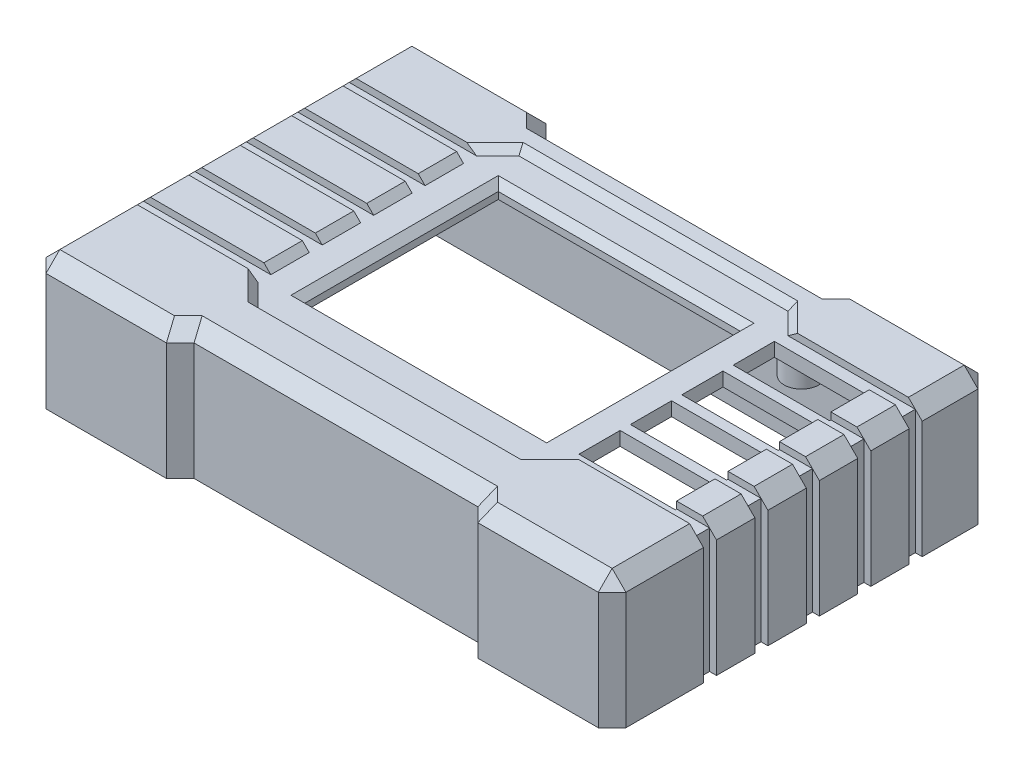
from build123d import *

# Parameters (mm, degrees)
SKETCH_1_W          = 74
SKETCH_1_H          = 45
SKETCH_1_W_2        = 35.04
SKETCH_1_H_2        = 28.03
SKETCH_1_W_3        = 13.543974178
SKETCH_1_H_3        = 5.562046036
EXTRUDE_1_DEPTH     = 2
SKETCH_2_W          = 45
SKETCH_2_H          = 18
EXTRUDE_2_DEPTH     = 4
SKETCH_3_W          = 45
SKETCH_3_H          = 18
EXTRUDE_3_DEPTH     = 4
SKETCH_4_W          = 82
SKETCH_4_H          = 18
EXTRUDE_4_DEPTH     = 3
SKETCH_5_W          = 82
SKETCH_5_H          = 18
EXTRUDE_5_DEPTH     = 3
SKETCH_7_W          = 4.978012911
SKETCH_7_H          = 5.562046036
SKETCH_7_W_2        = 18.446306877
EXTRUDE_6_DEPTH     = 1
SKETCH_8_W          = 5.562046036
SKETCH_8_H          = 19
SKETCH_8_W_2        = 11.231023018
SKETCH_8_W_3        = 8.081023018
EXTRUDE_7_DEPTH     = 1
SKETCH_9_W          = 5.562046036
SKETCH_9_H          = 19
SKETCH_9_W_2        = 11.231023018
SKETCH_9_W_3        = 8.081023018
EXTRUDE_8_DEPTH     = 1
EXTRUDE_9_DEPTH     = 19
CHAMFER_15_SIZE     = 2
CHAMFER_16_SIZE     = 1
SKETCH_12_R         = 2.5
SKETCH_12_R_2       = 0.9
EXTRUDE_10_DEPTH    = 3.25
EXTRUDE_11_DEPTH    = 16
SKETCH_15_R         = 0.9
CUT_EXTRUDE_1_DEPTH = 16
SKETCH_16_R         = 1.6
CUT_EXTRUDE_3_DEPTH = 86.166014348
CUT_EXTRUDE_4_DEPTH = 86.166014348
CUT_EXTRUDE_5_DEPTH = 2.5
CHAMFER_17_SIZE     = 1
SKETCH_19_W         = 13.943974178
SKETCH_19_H         = 5.962046036
CUT_EXTRUDE_6_DEPTH = 3
SKETCH_20_R         = 3.2
CUT_EXTRUDE_7_DEPTH = 2.2
CHAMFER_18_SIZE     = 1


with BuildPart() as part:
    # Эскиз1 → Бобышка-Вытянуть1 (new body)
    with BuildSketch(Plane(origin=(0, 0, 0), x_dir=(1, 0, 0), z_dir=(0, 1, 0))):
        Rectangle(SKETCH_1_W, SKETCH_1_H)
        with Locations((0, 1.516023018)):
            Rectangle(SKETCH_1_W_2, SKETCH_1_H_2, mode=Mode.SUBTRACT)
        with Locations((29.25, 12.75)):
            Rectangle(SKETCH_1_W_3, SKETCH_1_H_3, mode=Mode.SUBTRACT)
        with Locations((29.25, 5.3)):
            Rectangle(SKETCH_1_W_3, SKETCH_1_H_3, mode=Mode.SUBTRACT)
        with Locations((29.25, -2.15)):
            Rectangle(SKETCH_1_W_3, SKETCH_1_H_3, mode=Mode.SUBTRACT)
        with Locations((29.25, -9.6)):
            Rectangle(SKETCH_1_W_3, SKETCH_1_H_3, mode=Mode.SUBTRACT)
    extrude(amount=EXTRUDE_1_DEPTH)

    # Эскиз2 → Бобышка-Вытянуть2 (add)
    with BuildSketch(Plane.ZY.offset(37)):
        with Locations((0, -7)):
            Rectangle(SKETCH_2_W, SKETCH_2_H)
    extrude(amount=EXTRUDE_2_DEPTH)

    # Эскиз3 → Бобышка-Вытянуть3 (add)
    with BuildSketch(Plane(origin=(37, 0, 0), x_dir=(0, 0, -1), z_dir=(1, 0, 0))):
        with Locations((0, -7)):
            Rectangle(SKETCH_3_W, SKETCH_3_H)
    extrude(amount=EXTRUDE_3_DEPTH)

    # Эскиз4 → Бобышка-Вытянуть4 (add)
    with BuildSketch(Plane(origin=(0, 0, -22.5), x_dir=(-1, 0, 0), z_dir=(0, 0, -1))):
        with Locations((0, -7)):
            Rectangle(SKETCH_4_W, SKETCH_4_H)
    extrude(amount=EXTRUDE_4_DEPTH)

    # Эскиз5 → Бобышка-Вытянуть5 (add)
    with BuildSketch(Plane.XY.offset(22.5)):
        with Locations((0, -7)):
            Rectangle(SKETCH_5_W, SKETCH_5_H)
    extrude(amount=EXTRUDE_5_DEPTH)

    # Эскиз7 → Бобышка-Вытянуть6 (add)
    with BuildSketch(Plane(origin=(0, 2, 0), x_dir=(1, 0, 0), z_dir=(0, 1, 0))):
        with Locations((38.510993544, 12.75)):
            Rectangle(SKETCH_7_W, SKETCH_7_H)
        with Locations((-31.776846562, -9.6)):
            Rectangle(SKETCH_7_W_2, SKETCH_7_H)
        with Locations((-31.776846562, -2.15)):
            Rectangle(SKETCH_7_W_2, SKETCH_7_H)
        with Locations((-31.776846562, 5.3)):
            Rectangle(SKETCH_7_W_2, SKETCH_7_H)
        with Locations((-31.776846562, 12.75)):
            Rectangle(SKETCH_7_W_2, SKETCH_7_H)
        with Locations((38.510993544, 5.3)):
            Rectangle(SKETCH_7_W, SKETCH_7_H)
        with Locations((38.510993544, -2.15)):
            Rectangle(SKETCH_7_W, SKETCH_7_H)
        with Locations((38.510993544, -9.6)):
            Rectangle(SKETCH_7_W, SKETCH_7_H)
        Polygon((-41, -25.5), (-22.553693123, -25.5), (22.553693123, -25.5), (41, -25.5), (41, -14.268976982), (22.553693123, -14.268976982), (19.365680212, -17.456989893), (-19.365680212, -17.456989893), (-22.553693123, -14.268976982), (-41, -14.268976982), align=None)
        Polygon((-22.553693123, 17.418976982), (-41, 17.418976982), (-41, 25.5), (-22.553693123, 25.5), (22.553693123, 25.5), (41, 25.5), (41, 17.418976982), (22.553693123, 17.418976982), (19.483634175, 20.48903593), (-19.483634175, 20.48903593), align=None)
    extrude(amount=EXTRUDE_6_DEPTH)

    # Эскиз8 → Бобышка-Вытянуть7 (add)
    with BuildSketch(Plane.ZY.offset(41)):
        with Locations((-12.75, -6.5)):
            Rectangle(SKETCH_8_W, SKETCH_8_H)
        with Locations((19.884488491, -6.5)):
            Rectangle(SKETCH_8_W_2, SKETCH_8_H)
        with Locations((-5.3, -6.5)):
            Rectangle(SKETCH_8_W, SKETCH_8_H)
        with Locations((2.15, -6.5)):
            Rectangle(SKETCH_8_W, SKETCH_8_H)
        with Locations((9.6, -6.5)):
            Rectangle(SKETCH_8_W, SKETCH_8_H)
        with Locations((-21.459488491, -6.5)):
            Rectangle(SKETCH_8_W_3, SKETCH_8_H)
    extrude(amount=EXTRUDE_7_DEPTH)

    # Эскиз9 → Бобышка-Вытянуть8 (add)
    with BuildSketch(Plane(origin=(41, 0, 0), x_dir=(0, 0, -1), z_dir=(1, 0, 0))):
        with Locations((-9.6, -6.5)):
            Rectangle(SKETCH_9_W, SKETCH_9_H)
        with Locations((-19.884488491, -6.5)):
            Rectangle(SKETCH_9_W_2, SKETCH_9_H)
        with Locations((-2.15, -6.5)):
            Rectangle(SKETCH_9_W, SKETCH_9_H)
        with Locations((5.3, -6.5)):
            Rectangle(SKETCH_9_W, SKETCH_9_H)
        with Locations((12.75, -6.5)):
            Rectangle(SKETCH_9_W, SKETCH_9_H)
        with Locations((21.459488491, -6.5)):
            Rectangle(SKETCH_9_W_3, SKETCH_9_H)
    extrude(amount=EXTRUDE_8_DEPTH)

    # Эскиз11 → Бобышка-Вытянуть9 (add)
    with BuildSketch(Plane(origin=(0, 3, 0), x_dir=(1, 0, 0), z_dir=(0, 1, 0))):
        Polygon((-42, 25.5), (-42, 27.5), (-22.553693123, 27.5), (-20.553693123, 25.5), align=None)
        Polygon((-42, -25.5), (-42, -27.5), (-22.553693123, -27.5), (-20.553693123, -25.5), align=None)
        Polygon((42, 25.5), (42, 27.5), (22.553693123, 27.5), (20.553693123, 25.5), align=None)
        Polygon((42, -25.5), (42, -27.5), (22.553693123, -27.5), (20.553693123, -25.5), align=None)
    extrude(amount=-EXTRUDE_9_DEPTH)

    # Фаска15
    chamfer_15_edges = [part.edges().sort_by_distance(p)[0] for p in [
        (-42, 3, -12.75),
        (-42, 3, -5.3),
        (-42, 3, 2.15),
        (-42, 3, 9.6),
        (-42, 3, 20.884488491),
        (-42, 3, -22.459488491),
        (42, 3, 9.6),
        (42, 3, 2.15),
        (42, 3, -5.3),
        (42, 3, -12.75),
        (42, 3, 20.884488491),
        (42, 3, -22.459488491),
        (-42, -6.5, -27.5),
        (-21.553693123, 3, -26.5),
        (-32.276846561, 3, -27.5),
        (0, 3, 25.5),
        (-42, -6.5, 27.5),
        (-32.276846561, 3, 27.5),
        (-21.553693123, 3, 26.5),
        (0, 3, -25.5),
        (42, -6.5, -27.5),
        (32.276846561, 3, -27.5),
        (21.553693123, 3, -26.5),
        (42, -6.5, 27.5),
        (21.553693123, 3, 26.5),
        (32.276846561, 3, 27.5),
    ]]
    chamfer(chamfer_15_edges, length=CHAMFER_15_SIZE - 0.0001)  # a hair under: the kernel refuses the full size

    # Фаска16
    chamfer_16_edges = [part.edges().sort_by_distance(p)[0] for p in [
        (20.959686667, 3, 15.862983437),
        (0, 3, 17.456989893),
        (-20.959686667, 3, 15.862983437),
        (-22.553693123, 3, 9.6),
        (-22.553693123, 3, 2.15),
        (-22.553693123, 3, -5.3),
        (-22.553693123, 3, -12.75),
        (21.018663649, 3, -18.954006456),
        (0, 3, -20.48903593),
        (-21.018663649, 3, -18.954006456),
    ]]
    chamfer(chamfer_16_edges, length=CHAMFER_16_SIZE - 0.0001)  # a hair under: the kernel refuses the full size

    # Эскиз12 → Бобышка-Вытянуть10 (add)
    # profile 1 of 4: a face of its own
    with BuildSketch(Plane.XZ):
        with Locations(Location((-28.48, 15.683976982, 0), (0, 0, 90))):
            Circle(SKETCH_12_R)
        with Locations(Location((-28.48, 15.683976982, 0), (0, 0, 90))):
            Circle(SKETCH_12_R_2, mode=Mode.SUBTRACT)
    # profile 2 of 4: a face of its own
    with BuildSketch(Plane.XZ):
        with Locations(Location((23.22, 15.683976982, 0), (0, 0, 90))):
            Circle(SKETCH_12_R)
        with Locations(Location((23.22, 15.683976982, 0), (0, 0, 90))):
            Circle(SKETCH_12_R_2, mode=Mode.SUBTRACT)
    # profile 3 of 4: a face of its own
    with BuildSketch(Plane.XZ):
        with Locations(Location((-28.48, -18.716023018, 0), (0, 0, 90))):
            Circle(SKETCH_12_R)
        with Locations(Location((-28.48, -18.716023018, 0), (0, 0, 90))):
            Circle(SKETCH_12_R_2, mode=Mode.SUBTRACT)
    # profile 4 of 4: a face of its own
    with BuildSketch(Plane.XZ):
        with Locations(Location((23.22, -18.716023018, 0), (0, 0, 90))):
            Circle(SKETCH_12_R)
        with Locations(Location((23.22, -18.716023018, 0), (0, 0, 90))):
            Circle(SKETCH_12_R_2, mode=Mode.SUBTRACT)
    extrude(amount=EXTRUDE_10_DEPTH)

    # Эскиз13 → Бобышка-Вытянуть11 (add)
    with BuildSketch(Plane.XZ):
        with BuildLine():
            Line((-37, -19.5), (-37, -22.5))
            Line((-37, -22.5), (-34, -22.5))
            ThreePointArc((-34, -22.5), (-34.878679656, -20.378679656), (-37, -19.5))
        make_face()
        with BuildLine():
            Line((-37, 22.5), (-34, 22.5))
            ThreePointArc((-34, 22.5), (-34.878679656, 20.378679656), (-37, 19.5))
            Line((-37, 19.5), (-37, 22.5))
        make_face()
        with BuildLine():
            Line((37, -22.5), (34, -22.5))
            ThreePointArc((34, -22.5), (34.878679656, -20.378679656), (37, -19.5))
            Line((37, -19.5), (37, -22.5))
        make_face()
        with BuildLine():
            Line((37, 22.5), (34, 22.5))
            ThreePointArc((34, 22.5), (34.878679656, 20.378679656), (37, 19.5))
            Line((37, 19.5), (37, 22.5))
        make_face()
    extrude(amount=EXTRUDE_11_DEPTH)

    # Эскиз15 → Вырез-Вытянуть1 (cut)
    with BuildSketch(Plane.XZ.offset(16)):
        with Locations(Location((-37, -22.5, 0), (0, 0, 270))):
            Circle(SKETCH_15_R)
        with Locations(Location((-37, 22.5, 0), (0, 0, 270))):
            Circle(SKETCH_15_R)
        with Locations(Location((37, -22.5, 0), (0, 0, 270))):
            Circle(SKETCH_15_R)
        with Locations(Location((37, 22.5, 0), (0, 0, 270))):
            Circle(SKETCH_15_R)
    extrude(amount=-CUT_EXTRUDE_1_DEPTH, mode=Mode.SUBTRACT)

    # Эскиз16 → Вырез-Вытянуть3 (cut, through all)
    with BuildSketch(Plane(origin=(-37, 0, 0), x_dir=(0, 0, -1), z_dir=(1, 0, 0))):
        with Locations((13.4, -16)):
            Circle(SKETCH_16_R)
    extrude(amount=-CUT_EXTRUDE_3_DEPTH, mode=Mode.SUBTRACT)

    # Эскиз17 → Вырез-Вытянуть4 (cut, through all)
    with BuildSketch(Plane(origin=(-37, 0, 0), x_dir=(0, 0, -1), z_dir=(1, 0, 0))):
        Polygon((2.27, -16), (2.27, -15.758578644), (2.828578644, -15.2), (9.911421356, -15.2), (10.47, -15.758578644), (10.47, -16), align=None)
    extrude(amount=-CUT_EXTRUDE_4_DEPTH, mode=Mode.SUBTRACT)

    # Эскиз18 → Вырез-Вытянуть5 (cut)
    with BuildSketch(Plane.ZY.offset(42)):
        Polygon((-17.418976982, -16), (-17.418976982, -13.4), (-16.418976982, -12.4), (-1.631023018, -12.4), (-0.631023018, -13.4), (-0.631023018, -16), align=None)
    extrude(amount=-CUT_EXTRUDE_5_DEPTH, mode=Mode.SUBTRACT)

    # Фаска17
    chamfer_17_edges = [part.edges().sort_by_distance(p)[0] for p in [
        (17.52, 2, -1.516023018),
        (0, 2, -15.531023018),
        (-17.52, 2, -1.516023018),
        (0, 2, 12.498976982),
    ]]
    chamfer(chamfer_17_edges, length=CHAMFER_17_SIZE)

    # Эскиз19 → Вырез-Вытянуть6 (cut)
    with BuildSketch(Plane(origin=(0, 3, 0), x_dir=(1, 0, 0), z_dir=(0, 1, 0))):
        with Locations((29.25, 12.75)):
            Rectangle(SKETCH_19_W, SKETCH_19_H)
        with Locations((29.25, 5.3)):
            Rectangle(SKETCH_19_W, SKETCH_19_H)
        with Locations((29.25, -2.15)):
            Rectangle(SKETCH_19_W, SKETCH_19_H)
        with Locations((29.25, -9.6)):
            Rectangle(SKETCH_19_W, SKETCH_19_H)
    extrude(amount=-CUT_EXTRUDE_6_DEPTH, mode=Mode.SUBTRACT)

    # Эскиз20 → Вырез-Вытянуть7 (cut)
    with BuildSketch(Plane(origin=(0, 0, 22.5), x_dir=(-1, 0, 0), z_dir=(0, 0, -1))):
        with Locations((-30, -8)):
            Circle(SKETCH_20_R)
        with Locations((30, -8)):
            Circle(SKETCH_20_R)
    extrude(amount=-CUT_EXTRUDE_7_DEPTH, mode=Mode.SUBTRACT)

    # Фаска18
    chamfer_18_edges = [part.edges().sort_by_distance(p)[0] for p in [
        (-42, -12.4, -5.3),
        (-42, -12.4, -12.75),
    ]]
    chamfer(chamfer_18_edges, length=CHAMFER_18_SIZE)


solid = part.part
